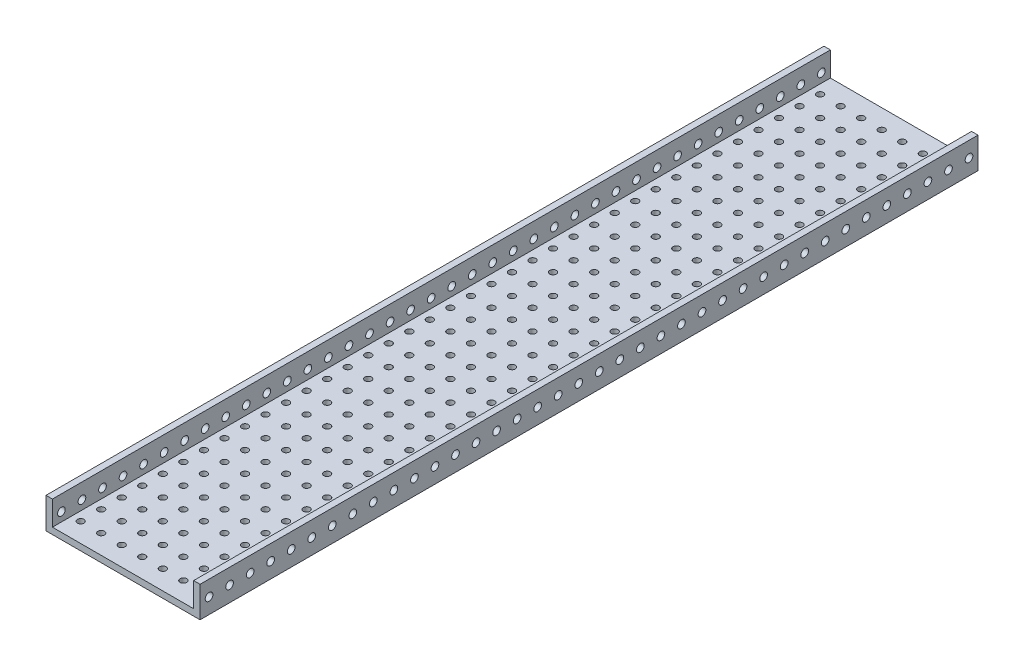
from build123d import *

# Parameters (mm, degrees)
EXTRUDE1_DEPTH        = 192.405
F_6_CLEARANCE_HOLE1_D = 3.7973
LPATTERN1_COUNT       = 38
LPATTERN1_PITCH       = 10.16
F_4_CLEARANCE_HOLE1_D = 3.2639
LPATTERN2_COUNT       = 4
LPATTERN2_PITCH       = 10.16
LPATTERN2_COL_COUNT   = 4
LPATTERN2_COL_PITCH   = 10.16
LPATTERN3_COUNT       = 37
LPATTERN3_PITCH       = 10.16
LPATTERN3_COPY_1_D    = 3.2639
LPATTERN3_COPY_2_D    = 3.2639
LPATTERN3_COPY_3_D    = 3.2639
LPATTERN3_COPY_4_D    = 3.2639
LPATTERN3_COPY_5_D    = 3.2639
LPATTERN3_COPY_6_D    = 3.2639
LPATTERN3_COPY_7_D    = 3.2639
LPATTERN3_COPY_8_D    = 3.2639
LPATTERN3_COPY_9_D    = 3.2639
LPATTERN3_COPY_10_D   = 3.2639
LPATTERN3_COPY_11_D   = 3.2639
LPATTERN3_COPY_12_D   = 3.2639
LPATTERN3_COPY_13_D   = 3.2639
LPATTERN3_COPY_14_D   = 3.2639
LPATTERN3_COPY_15_D   = 3.2639
LPATTERN3_COPY_16_D   = 3.2639
LPATTERN3_COPY_17_D   = 3.2639
LPATTERN3_COPY_18_D   = 3.2639
LPATTERN3_COPY_19_D   = 3.2639
LPATTERN3_COPY_20_D   = 3.2639
LPATTERN3_COPY_21_D   = 3.2639
LPATTERN3_COPY_22_D   = 3.2639
LPATTERN3_COPY_23_D   = 3.2639
LPATTERN3_COPY_24_D   = 3.2639
LPATTERN3_COPY_25_D   = 3.2639
LPATTERN3_COPY_26_D   = 3.2639
LPATTERN3_COPY_27_D   = 3.2639
LPATTERN3_COPY_28_D   = 3.2639
LPATTERN3_COPY_29_D   = 3.2639
LPATTERN3_COPY_30_D   = 3.2639
LPATTERN3_COPY_31_D   = 3.2639
LPATTERN3_COPY_32_D   = 3.2639
LPATTERN3_COPY_33_D   = 3.2639
LPATTERN3_COPY_34_D   = 3.2639
LPATTERN3_COPY_35_D   = 3.2639
LPATTERN3_COPY_36_D   = 3.2639
LPATTERN3_COPY_37_D   = 3.2639
LPATTERN3_COPY_38_D   = 3.2639
LPATTERN3_COPY_39_D   = 3.2639
LPATTERN3_COPY_40_D   = 3.2639
LPATTERN3_COPY_41_D   = 3.2639
LPATTERN3_COPY_42_D   = 3.2639
LPATTERN3_COPY_43_D   = 3.2639
LPATTERN3_COPY_44_D   = 3.2639
LPATTERN3_COPY_45_D   = 3.2639
LPATTERN3_COPY_46_D   = 3.2639
LPATTERN3_COPY_47_D   = 3.2639
LPATTERN3_COPY_48_D   = 3.2639
LPATTERN3_COPY_49_D   = 3.2639
LPATTERN3_COPY_50_D   = 3.2639
LPATTERN3_COPY_51_D   = 3.2639
LPATTERN3_COPY_52_D   = 3.2639
LPATTERN3_COPY_53_D   = 3.2639
LPATTERN3_COPY_54_D   = 3.2639
LPATTERN3_COPY_55_D   = 3.2639
LPATTERN3_COPY_56_D   = 3.2639
LPATTERN3_COPY_57_D   = 3.2639
LPATTERN3_COPY_58_D   = 3.2639
LPATTERN3_COPY_59_D   = 3.2639
LPATTERN3_COPY_60_D   = 3.2639
LPATTERN3_COPY_61_D   = 3.2639
LPATTERN3_COPY_62_D   = 3.2639
LPATTERN3_COPY_63_D   = 3.2639
LPATTERN3_COPY_64_D   = 3.2639
LPATTERN3_COPY_65_D   = 3.2639
LPATTERN3_COPY_66_D   = 3.2639
LPATTERN3_COPY_67_D   = 3.2639
LPATTERN3_COPY_68_D   = 3.2639
LPATTERN3_COPY_69_D   = 3.2639
LPATTERN3_COPY_70_D   = 3.2639
LPATTERN3_COPY_71_D   = 3.2639
LPATTERN3_COPY_72_D   = 3.2639
LPATTERN3_COPY_73_D   = 3.2639
LPATTERN3_COPY_74_D   = 3.2639
LPATTERN3_COPY_75_D   = 3.2639
LPATTERN3_COPY_76_D   = 3.2639
LPATTERN3_COPY_77_D   = 3.2639
LPATTERN3_COPY_78_D   = 3.2639
LPATTERN3_COPY_79_D   = 3.2639
LPATTERN3_COPY_80_D   = 3.2639
LPATTERN3_COPY_81_D   = 3.2639
LPATTERN3_COPY_82_D   = 3.2639
LPATTERN3_COPY_83_D   = 3.2639
LPATTERN3_COPY_84_D   = 3.2639
LPATTERN3_COPY_85_D   = 3.2639
LPATTERN3_COPY_86_D   = 3.2639
LPATTERN3_COPY_87_D   = 3.2639
LPATTERN3_COPY_88_D   = 3.2639
LPATTERN3_COPY_89_D   = 3.2639
LPATTERN3_COPY_90_D   = 3.2639
LPATTERN3_COPY_91_D   = 3.2639
LPATTERN3_COPY_92_D   = 3.2639
LPATTERN3_COPY_93_D   = 3.2639
LPATTERN3_COPY_94_D   = 3.2639
LPATTERN3_COPY_95_D   = 3.2639
LPATTERN3_COPY_96_D   = 3.2639
LPATTERN3_COPY_97_D   = 3.2639
LPATTERN3_COPY_98_D   = 3.2639
LPATTERN3_COPY_99_D   = 3.2639
LPATTERN3_COPY_100_D  = 3.2639
LPATTERN3_COPY_101_D  = 3.2639
LPATTERN3_COPY_102_D  = 3.2639
LPATTERN3_COPY_103_D  = 3.2639
LPATTERN3_COPY_104_D  = 3.2639
LPATTERN3_COPY_105_D  = 3.2639
LPATTERN3_COPY_106_D  = 3.2639
LPATTERN3_COPY_107_D  = 3.2639
LPATTERN3_COPY_108_D  = 3.2639
LPATTERN3_COPY_109_D  = 3.2639
LPATTERN3_COPY_110_D  = 3.2639
LPATTERN3_COPY_111_D  = 3.2639
LPATTERN3_COPY_112_D  = 3.2639
LPATTERN3_COPY_113_D  = 3.2639
LPATTERN3_COPY_114_D  = 3.2639
LPATTERN3_COPY_115_D  = 3.2639
LPATTERN3_COPY_116_D  = 3.2639
LPATTERN3_COPY_117_D  = 3.2639
LPATTERN3_COPY_118_D  = 3.2639
LPATTERN3_COPY_119_D  = 3.2639
LPATTERN3_COPY_120_D  = 3.2639
LPATTERN3_COPY_121_D  = 3.2639
LPATTERN3_COPY_122_D  = 3.2639
LPATTERN3_COPY_123_D  = 3.2639
LPATTERN3_COPY_124_D  = 3.2639
LPATTERN3_COPY_125_D  = 3.2639
LPATTERN3_COPY_126_D  = 3.2639
LPATTERN3_COPY_127_D  = 3.2639
LPATTERN3_COPY_128_D  = 3.2639
LPATTERN3_COPY_129_D  = 3.2639
LPATTERN3_COPY_130_D  = 3.2639
LPATTERN3_COPY_131_D  = 3.2639
LPATTERN3_COPY_132_D  = 3.2639
LPATTERN3_COPY_133_D  = 3.2639
LPATTERN3_COPY_134_D  = 3.2639
LPATTERN3_COPY_135_D  = 3.2639
LPATTERN3_COPY_136_D  = 3.2639
LPATTERN3_COPY_137_D  = 3.2639
LPATTERN3_COPY_138_D  = 3.2639
LPATTERN3_COPY_139_D  = 3.2639
LPATTERN3_COPY_140_D  = 3.2639
LPATTERN3_COPY_141_D  = 3.2639
LPATTERN3_COPY_142_D  = 3.2639
LPATTERN3_COPY_143_D  = 3.2639
LPATTERN3_COPY_144_D  = 3.2639
LPATTERN3_COPY_145_D  = 3.2639
LPATTERN3_COPY_146_D  = 3.2639
LPATTERN3_COPY_147_D  = 3.2639
LPATTERN3_COPY_148_D  = 3.2639
LPATTERN3_COPY_149_D  = 3.2639
LPATTERN3_COPY_150_D  = 3.2639
LPATTERN3_COPY_151_D  = 3.2639
LPATTERN3_COPY_152_D  = 3.2639
LPATTERN3_COPY_153_D  = 3.2639
LPATTERN3_COPY_154_D  = 3.2639
LPATTERN3_COPY_155_D  = 3.2639
LPATTERN3_COPY_156_D  = 3.2639
LPATTERN3_COPY_157_D  = 3.2639
LPATTERN3_COPY_158_D  = 3.2639
LPATTERN3_COPY_159_D  = 3.2639
LPATTERN3_COPY_160_D  = 3.2639
LPATTERN3_COPY_161_D  = 3.2639
LPATTERN3_COPY_162_D  = 3.2639
LPATTERN3_COPY_163_D  = 3.2639
LPATTERN3_COPY_164_D  = 3.2639
LPATTERN3_COPY_165_D  = 3.2639
LPATTERN3_COPY_166_D  = 3.2639
LPATTERN3_COPY_167_D  = 3.2639
LPATTERN3_COPY_168_D  = 3.2639
LPATTERN3_COPY_169_D  = 3.2639
LPATTERN3_COPY_170_D  = 3.2639
LPATTERN3_COPY_171_D  = 3.2639
LPATTERN3_COPY_172_D  = 3.2639
LPATTERN3_COPY_173_D  = 3.2639
LPATTERN3_COPY_174_D  = 3.2639
LPATTERN3_COPY_175_D  = 3.2639
LPATTERN3_COPY_176_D  = 3.2639
LPATTERN3_COPY_177_D  = 3.2639
LPATTERN3_COPY_178_D  = 3.2639
LPATTERN3_COPY_179_D  = 3.2639
LPATTERN3_COPY_180_D  = 3.2639
LPATTERN3_COPY_181_D  = 3.2639
LPATTERN3_COPY_182_D  = 3.2639
LPATTERN3_COPY_183_D  = 3.2639
LPATTERN3_COPY_184_D  = 3.2639
LPATTERN3_COPY_185_D  = 3.2639
LPATTERN3_COPY_186_D  = 3.2639
LPATTERN3_COPY_187_D  = 3.2639
LPATTERN3_COPY_188_D  = 3.2639
LPATTERN3_COPY_189_D  = 3.2639
LPATTERN3_COPY_190_D  = 3.2639
LPATTERN3_COPY_191_D  = 3.2639
LPATTERN3_COPY_192_D  = 3.2639
LPATTERN3_COPY_193_D  = 3.2639
LPATTERN3_COPY_194_D  = 3.2639
LPATTERN3_COPY_195_D  = 3.2639
LPATTERN3_COPY_196_D  = 3.2639
LPATTERN3_COPY_197_D  = 3.2639
LPATTERN3_COPY_198_D  = 3.2639
LPATTERN3_COPY_199_D  = 3.2639
LPATTERN3_COPY_200_D  = 3.2639
LPATTERN3_COPY_201_D  = 3.2639
LPATTERN3_COPY_202_D  = 3.2639
LPATTERN3_COPY_203_D  = 3.2639
LPATTERN3_COPY_204_D  = 3.2639
LPATTERN3_COPY_205_D  = 3.2639
LPATTERN3_COPY_206_D  = 3.2639
LPATTERN3_COPY_207_D  = 3.2639
LPATTERN3_COPY_208_D  = 3.2639
LPATTERN3_COPY_209_D  = 3.2639
LPATTERN3_COPY_210_D  = 3.2639
LPATTERN3_COPY_211_D  = 3.2639
LPATTERN3_COPY_212_D  = 3.2639
LPATTERN3_COPY_213_D  = 3.2639
LPATTERN3_COPY_214_D  = 3.2639
LPATTERN3_COPY_215_D  = 3.2639
LPATTERN3_COPY_216_D  = 3.2639


with BuildPart() as part:
    # Sketch1 → Extrude1 (new, symmetric)
    with BuildSketch(Plane.XY):
        Polygon((0, 0), (38.1, 0), (38.1, 15.24), (34.925, 15.24), (34.925, 3.175), (-34.925, 3.175), (-34.925, 15.24), (-38.1, 15.24), (-38.1, 0), align=None)
    extrude(amount=EXTRUDE1_DEPTH, both=True)

    # #6 Clearance Hole1 (through all)
    with Locations(Plane(origin=(38.1, 7.62, 187.96), x_dir=(0, 0, 1), z_dir=(1, 0, 0))):
        with Locations((0, 0)):
            f_6_clearance_hole1 = Hole(F_6_CLEARANCE_HOLE1_D / 2)

    # LPattern1: #6 Clearance Hole1 ×38
    with Locations(*[(0, 0, -i * LPATTERN1_PITCH) for i in range(1, LPATTERN1_COUNT)]):
        add(f_6_clearance_hole1, mode=Mode.SUBTRACT)

    # #4 Clearance Hole1 (through all)
    with Locations(Plane(origin=(0, 0, 182.88), x_dir=(0, 0, -1), z_dir=(0, -1, 0))):
        with Locations((0, 0)):
            f_4_clearance_hole1 = Hole(F_4_CLEARANCE_HOLE1_D / 2)

    # LPattern2: #4 Clearance Hole1 ×4
    with Locations(*[(i * LPATTERN2_PITCH, 0, 0) for i in range(1, LPATTERN2_COUNT)]):
        add(f_4_clearance_hole1, mode=Mode.SUBTRACT)

    # LPattern2 col: #4 Clearance Hole1 ×4
    with Locations(*[(-i * LPATTERN2_COL_PITCH, 0, 0) for i in range(1, LPATTERN2_COL_COUNT)]):
        add(f_4_clearance_hole1, mode=Mode.SUBTRACT)

    # LPattern3: #4 Clearance Hole1 ×37
    with Locations(*[(0, 0, -i * LPATTERN3_PITCH) for i in range(1, LPATTERN3_COUNT)]):
        add(f_4_clearance_hole1, mode=Mode.SUBTRACT)

    # LPattern3 copy 1 (through all)
    with Locations(Plane(origin=(10.16, 0, 172.72), x_dir=(0, 0, -1), z_dir=(0, -1, 0))):
        with Locations((0, 0)):
            Hole(LPATTERN3_COPY_1_D / 2)

    # LPattern3 copy 2 (through all)
    with Locations(Plane(origin=(10.16, 0, 162.56), x_dir=(0, 0, -1), z_dir=(0, -1, 0))):
        with Locations((0, 0)):
            Hole(LPATTERN3_COPY_2_D / 2)

    # LPattern3 copy 3 (through all)
    with Locations(Plane(origin=(10.16, 0, 152.4), x_dir=(0, 0, -1), z_dir=(0, -1, 0))):
        with Locations((0, 0)):
            Hole(LPATTERN3_COPY_3_D / 2)

    # LPattern3 copy 4 (through all)
    with Locations(Plane(origin=(10.16, 0, 142.24), x_dir=(0, 0, -1), z_dir=(0, -1, 0))):
        with Locations((0, 0)):
            Hole(LPATTERN3_COPY_4_D / 2)

    # LPattern3 copy 5 (through all)
    with Locations(Plane(origin=(10.16, 0, 132.08), x_dir=(0, 0, -1), z_dir=(0, -1, 0))):
        with Locations((0, 0)):
            Hole(LPATTERN3_COPY_5_D / 2)

    # LPattern3 copy 6 (through all)
    with Locations(Plane(origin=(10.16, 0, 121.92), x_dir=(0, 0, -1), z_dir=(0, -1, 0))):
        with Locations((0, 0)):
            Hole(LPATTERN3_COPY_6_D / 2)

    # LPattern3 copy 7 (through all)
    with Locations(Plane(origin=(10.16, 0, 111.76), x_dir=(0, 0, -1), z_dir=(0, -1, 0))):
        with Locations((0, 0)):
            Hole(LPATTERN3_COPY_7_D / 2)

    # LPattern3 copy 8 (through all)
    with Locations(Plane(origin=(10.16, 0, 101.6), x_dir=(0, 0, -1), z_dir=(0, -1, 0))):
        with Locations((0, 0)):
            Hole(LPATTERN3_COPY_8_D / 2)

    # LPattern3 copy 9 (through all)
    with Locations(Plane(origin=(10.16, 0, 91.44), x_dir=(0, 0, -1), z_dir=(0, -1, 0))):
        with Locations((0, 0)):
            Hole(LPATTERN3_COPY_9_D / 2)

    # LPattern3 copy 10 (through all)
    with Locations(Plane(origin=(10.16, 0, 81.28), x_dir=(0, 0, -1), z_dir=(0, -1, 0))):
        with Locations((0, 0)):
            Hole(LPATTERN3_COPY_10_D / 2)

    # LPattern3 copy 11 (through all)
    with Locations(Plane(origin=(10.16, 0, 71.12), x_dir=(0, 0, -1), z_dir=(0, -1, 0))):
        with Locations((0, 0)):
            Hole(LPATTERN3_COPY_11_D / 2)

    # LPattern3 copy 12 (through all)
    with Locations(Plane(origin=(10.16, 0, 60.96), x_dir=(0, 0, -1), z_dir=(0, -1, 0))):
        with Locations((0, 0)):
            Hole(LPATTERN3_COPY_12_D / 2)

    # LPattern3 copy 13 (through all)
    with Locations(Plane(origin=(10.16, 0, 50.8), x_dir=(0, 0, -1), z_dir=(0, -1, 0))):
        with Locations((0, 0)):
            Hole(LPATTERN3_COPY_13_D / 2)

    # LPattern3 copy 14 (through all)
    with Locations(Plane(origin=(10.16, 0, 40.64), x_dir=(0, 0, -1), z_dir=(0, -1, 0))):
        with Locations((0, 0)):
            Hole(LPATTERN3_COPY_14_D / 2)

    # LPattern3 copy 15 (through all)
    with Locations(Plane(origin=(10.16, 0, 30.48), x_dir=(0, 0, -1), z_dir=(0, -1, 0))):
        with Locations((0, 0)):
            Hole(LPATTERN3_COPY_15_D / 2)

    # LPattern3 copy 16 (through all)
    with Locations(Plane(origin=(10.16, 0, 20.32), x_dir=(0, 0, -1), z_dir=(0, -1, 0))):
        with Locations((0, 0)):
            Hole(LPATTERN3_COPY_16_D / 2)

    # LPattern3 copy 17 (through all)
    with Locations(Plane(origin=(10.16, 0, 10.16), x_dir=(0, 0, -1), z_dir=(0, -1, 0))):
        with Locations((0, 0)):
            Hole(LPATTERN3_COPY_17_D / 2)

    # LPattern3 copy 18 (through all)
    with Locations(Plane(origin=(10.16, 0, 0), x_dir=(0, 0, -1), z_dir=(0, -1, 0))):
        with Locations((0, 0)):
            Hole(LPATTERN3_COPY_18_D / 2)

    # LPattern3 copy 19 (through all)
    with Locations(Plane(origin=(10.16, 0, -10.16), x_dir=(0, 0, -1), z_dir=(0, -1, 0))):
        with Locations((0, 0)):
            Hole(LPATTERN3_COPY_19_D / 2)

    # LPattern3 copy 20 (through all)
    with Locations(Plane(origin=(10.16, 0, -20.32), x_dir=(0, 0, -1), z_dir=(0, -1, 0))):
        with Locations((0, 0)):
            Hole(LPATTERN3_COPY_20_D / 2)

    # LPattern3 copy 21 (through all)
    with Locations(Plane(origin=(10.16, 0, -30.48), x_dir=(0, 0, -1), z_dir=(0, -1, 0))):
        with Locations((0, 0)):
            Hole(LPATTERN3_COPY_21_D / 2)

    # LPattern3 copy 22 (through all)
    with Locations(Plane(origin=(10.16, 0, -40.64), x_dir=(0, 0, -1), z_dir=(0, -1, 0))):
        with Locations((0, 0)):
            Hole(LPATTERN3_COPY_22_D / 2)

    # LPattern3 copy 23 (through all)
    with Locations(Plane(origin=(10.16, 0, -50.8), x_dir=(0, 0, -1), z_dir=(0, -1, 0))):
        with Locations((0, 0)):
            Hole(LPATTERN3_COPY_23_D / 2)

    # LPattern3 copy 24 (through all)
    with Locations(Plane(origin=(10.16, 0, -60.96), x_dir=(0, 0, -1), z_dir=(0, -1, 0))):
        with Locations((0, 0)):
            Hole(LPATTERN3_COPY_24_D / 2)

    # LPattern3 copy 25 (through all)
    with Locations(Plane(origin=(10.16, 0, -71.12), x_dir=(0, 0, -1), z_dir=(0, -1, 0))):
        with Locations((0, 0)):
            Hole(LPATTERN3_COPY_25_D / 2)

    # LPattern3 copy 26 (through all)
    with Locations(Plane(origin=(10.16, 0, -81.28), x_dir=(0, 0, -1), z_dir=(0, -1, 0))):
        with Locations((0, 0)):
            Hole(LPATTERN3_COPY_26_D / 2)

    # LPattern3 copy 27 (through all)
    with Locations(Plane(origin=(10.16, 0, -91.44), x_dir=(0, 0, -1), z_dir=(0, -1, 0))):
        with Locations((0, 0)):
            Hole(LPATTERN3_COPY_27_D / 2)

    # LPattern3 copy 28 (through all)
    with Locations(Plane(origin=(10.16, 0, -101.6), x_dir=(0, 0, -1), z_dir=(0, -1, 0))):
        with Locations((0, 0)):
            Hole(LPATTERN3_COPY_28_D / 2)

    # LPattern3 copy 29 (through all)
    with Locations(Plane(origin=(10.16, 0, -111.76), x_dir=(0, 0, -1), z_dir=(0, -1, 0))):
        with Locations((0, 0)):
            Hole(LPATTERN3_COPY_29_D / 2)

    # LPattern3 copy 30 (through all)
    with Locations(Plane(origin=(10.16, 0, -121.92), x_dir=(0, 0, -1), z_dir=(0, -1, 0))):
        with Locations((0, 0)):
            Hole(LPATTERN3_COPY_30_D / 2)

    # LPattern3 copy 31 (through all)
    with Locations(Plane(origin=(10.16, 0, -132.08), x_dir=(0, 0, -1), z_dir=(0, -1, 0))):
        with Locations((0, 0)):
            Hole(LPATTERN3_COPY_31_D / 2)

    # LPattern3 copy 32 (through all)
    with Locations(Plane(origin=(10.16, 0, -142.24), x_dir=(0, 0, -1), z_dir=(0, -1, 0))):
        with Locations((0, 0)):
            Hole(LPATTERN3_COPY_32_D / 2)

    # LPattern3 copy 33 (through all)
    with Locations(Plane(origin=(10.16, 0, -152.4), x_dir=(0, 0, -1), z_dir=(0, -1, 0))):
        with Locations((0, 0)):
            Hole(LPATTERN3_COPY_33_D / 2)

    # LPattern3 copy 34 (through all)
    with Locations(Plane(origin=(10.16, 0, -162.56), x_dir=(0, 0, -1), z_dir=(0, -1, 0))):
        with Locations((0, 0)):
            Hole(LPATTERN3_COPY_34_D / 2)

    # LPattern3 copy 35 (through all)
    with Locations(Plane(origin=(10.16, 0, -172.72), x_dir=(0, 0, -1), z_dir=(0, -1, 0))):
        with Locations((0, 0)):
            Hole(LPATTERN3_COPY_35_D / 2)

    # LPattern3 copy 36 (through all)
    with Locations(Plane(origin=(10.16, 0, -182.88), x_dir=(0, 0, -1), z_dir=(0, -1, 0))):
        with Locations((0, 0)):
            Hole(LPATTERN3_COPY_36_D / 2)

    # LPattern3 copy 37 (through all)
    with Locations(Plane(origin=(20.32, 0, 172.72), x_dir=(0, 0, -1), z_dir=(0, -1, 0))):
        with Locations((0, 0)):
            Hole(LPATTERN3_COPY_37_D / 2)

    # LPattern3 copy 38 (through all)
    with Locations(Plane(origin=(20.32, 0, 162.56), x_dir=(0, 0, -1), z_dir=(0, -1, 0))):
        with Locations((0, 0)):
            Hole(LPATTERN3_COPY_38_D / 2)

    # LPattern3 copy 39 (through all)
    with Locations(Plane(origin=(20.32, 0, 152.4), x_dir=(0, 0, -1), z_dir=(0, -1, 0))):
        with Locations((0, 0)):
            Hole(LPATTERN3_COPY_39_D / 2)

    # LPattern3 copy 40 (through all)
    with Locations(Plane(origin=(20.32, 0, 142.24), x_dir=(0, 0, -1), z_dir=(0, -1, 0))):
        with Locations((0, 0)):
            Hole(LPATTERN3_COPY_40_D / 2)

    # LPattern3 copy 41 (through all)
    with Locations(Plane(origin=(20.32, 0, 132.08), x_dir=(0, 0, -1), z_dir=(0, -1, 0))):
        with Locations((0, 0)):
            Hole(LPATTERN3_COPY_41_D / 2)

    # LPattern3 copy 42 (through all)
    with Locations(Plane(origin=(20.32, 0, 121.92), x_dir=(0, 0, -1), z_dir=(0, -1, 0))):
        with Locations((0, 0)):
            Hole(LPATTERN3_COPY_42_D / 2)

    # LPattern3 copy 43 (through all)
    with Locations(Plane(origin=(20.32, 0, 111.76), x_dir=(0, 0, -1), z_dir=(0, -1, 0))):
        with Locations((0, 0)):
            Hole(LPATTERN3_COPY_43_D / 2)

    # LPattern3 copy 44 (through all)
    with Locations(Plane(origin=(20.32, 0, 101.6), x_dir=(0, 0, -1), z_dir=(0, -1, 0))):
        with Locations((0, 0)):
            Hole(LPATTERN3_COPY_44_D / 2)

    # LPattern3 copy 45 (through all)
    with Locations(Plane(origin=(20.32, 0, 91.44), x_dir=(0, 0, -1), z_dir=(0, -1, 0))):
        with Locations((0, 0)):
            Hole(LPATTERN3_COPY_45_D / 2)

    # LPattern3 copy 46 (through all)
    with Locations(Plane(origin=(20.32, 0, 81.28), x_dir=(0, 0, -1), z_dir=(0, -1, 0))):
        with Locations((0, 0)):
            Hole(LPATTERN3_COPY_46_D / 2)

    # LPattern3 copy 47 (through all)
    with Locations(Plane(origin=(20.32, 0, 71.12), x_dir=(0, 0, -1), z_dir=(0, -1, 0))):
        with Locations((0, 0)):
            Hole(LPATTERN3_COPY_47_D / 2)

    # LPattern3 copy 48 (through all)
    with Locations(Plane(origin=(20.32, 0, 60.96), x_dir=(0, 0, -1), z_dir=(0, -1, 0))):
        with Locations((0, 0)):
            Hole(LPATTERN3_COPY_48_D / 2)

    # LPattern3 copy 49 (through all)
    with Locations(Plane(origin=(20.32, 0, 50.8), x_dir=(0, 0, -1), z_dir=(0, -1, 0))):
        with Locations((0, 0)):
            Hole(LPATTERN3_COPY_49_D / 2)

    # LPattern3 copy 50 (through all)
    with Locations(Plane(origin=(20.32, 0, 40.64), x_dir=(0, 0, -1), z_dir=(0, -1, 0))):
        with Locations((0, 0)):
            Hole(LPATTERN3_COPY_50_D / 2)

    # LPattern3 copy 51 (through all)
    with Locations(Plane(origin=(20.32, 0, 30.48), x_dir=(0, 0, -1), z_dir=(0, -1, 0))):
        with Locations((0, 0)):
            Hole(LPATTERN3_COPY_51_D / 2)

    # LPattern3 copy 52 (through all)
    with Locations(Plane(origin=(20.32, 0, 20.32), x_dir=(0, 0, -1), z_dir=(0, -1, 0))):
        with Locations((0, 0)):
            Hole(LPATTERN3_COPY_52_D / 2)

    # LPattern3 copy 53 (through all)
    with Locations(Plane(origin=(20.32, 0, 10.16), x_dir=(0, 0, -1), z_dir=(0, -1, 0))):
        with Locations((0, 0)):
            Hole(LPATTERN3_COPY_53_D / 2)

    # LPattern3 copy 54 (through all)
    with Locations(Plane(origin=(20.32, 0, 0), x_dir=(0, 0, -1), z_dir=(0, -1, 0))):
        with Locations((0, 0)):
            Hole(LPATTERN3_COPY_54_D / 2)

    # LPattern3 copy 55 (through all)
    with Locations(Plane(origin=(20.32, 0, -10.16), x_dir=(0, 0, -1), z_dir=(0, -1, 0))):
        with Locations((0, 0)):
            Hole(LPATTERN3_COPY_55_D / 2)

    # LPattern3 copy 56 (through all)
    with Locations(Plane(origin=(20.32, 0, -20.32), x_dir=(0, 0, -1), z_dir=(0, -1, 0))):
        with Locations((0, 0)):
            Hole(LPATTERN3_COPY_56_D / 2)

    # LPattern3 copy 57 (through all)
    with Locations(Plane(origin=(20.32, 0, -30.48), x_dir=(0, 0, -1), z_dir=(0, -1, 0))):
        with Locations((0, 0)):
            Hole(LPATTERN3_COPY_57_D / 2)

    # LPattern3 copy 58 (through all)
    with Locations(Plane(origin=(20.32, 0, -40.64), x_dir=(0, 0, -1), z_dir=(0, -1, 0))):
        with Locations((0, 0)):
            Hole(LPATTERN3_COPY_58_D / 2)

    # LPattern3 copy 59 (through all)
    with Locations(Plane(origin=(20.32, 0, -50.8), x_dir=(0, 0, -1), z_dir=(0, -1, 0))):
        with Locations((0, 0)):
            Hole(LPATTERN3_COPY_59_D / 2)

    # LPattern3 copy 60 (through all)
    with Locations(Plane(origin=(20.32, 0, -60.96), x_dir=(0, 0, -1), z_dir=(0, -1, 0))):
        with Locations((0, 0)):
            Hole(LPATTERN3_COPY_60_D / 2)

    # LPattern3 copy 61 (through all)
    with Locations(Plane(origin=(20.32, 0, -71.12), x_dir=(0, 0, -1), z_dir=(0, -1, 0))):
        with Locations((0, 0)):
            Hole(LPATTERN3_COPY_61_D / 2)

    # LPattern3 copy 62 (through all)
    with Locations(Plane(origin=(20.32, 0, -81.28), x_dir=(0, 0, -1), z_dir=(0, -1, 0))):
        with Locations((0, 0)):
            Hole(LPATTERN3_COPY_62_D / 2)

    # LPattern3 copy 63 (through all)
    with Locations(Plane(origin=(20.32, 0, -91.44), x_dir=(0, 0, -1), z_dir=(0, -1, 0))):
        with Locations((0, 0)):
            Hole(LPATTERN3_COPY_63_D / 2)

    # LPattern3 copy 64 (through all)
    with Locations(Plane(origin=(20.32, 0, -101.6), x_dir=(0, 0, -1), z_dir=(0, -1, 0))):
        with Locations((0, 0)):
            Hole(LPATTERN3_COPY_64_D / 2)

    # LPattern3 copy 65 (through all)
    with Locations(Plane(origin=(20.32, 0, -111.76), x_dir=(0, 0, -1), z_dir=(0, -1, 0))):
        with Locations((0, 0)):
            Hole(LPATTERN3_COPY_65_D / 2)

    # LPattern3 copy 66 (through all)
    with Locations(Plane(origin=(20.32, 0, -121.92), x_dir=(0, 0, -1), z_dir=(0, -1, 0))):
        with Locations((0, 0)):
            Hole(LPATTERN3_COPY_66_D / 2)

    # LPattern3 copy 67 (through all)
    with Locations(Plane(origin=(20.32, 0, -132.08), x_dir=(0, 0, -1), z_dir=(0, -1, 0))):
        with Locations((0, 0)):
            Hole(LPATTERN3_COPY_67_D / 2)

    # LPattern3 copy 68 (through all)
    with Locations(Plane(origin=(20.32, 0, -142.24), x_dir=(0, 0, -1), z_dir=(0, -1, 0))):
        with Locations((0, 0)):
            Hole(LPATTERN3_COPY_68_D / 2)

    # LPattern3 copy 69 (through all)
    with Locations(Plane(origin=(20.32, 0, -152.4), x_dir=(0, 0, -1), z_dir=(0, -1, 0))):
        with Locations((0, 0)):
            Hole(LPATTERN3_COPY_69_D / 2)

    # LPattern3 copy 70 (through all)
    with Locations(Plane(origin=(20.32, 0, -162.56), x_dir=(0, 0, -1), z_dir=(0, -1, 0))):
        with Locations((0, 0)):
            Hole(LPATTERN3_COPY_70_D / 2)

    # LPattern3 copy 71 (through all)
    with Locations(Plane(origin=(20.32, 0, -172.72), x_dir=(0, 0, -1), z_dir=(0, -1, 0))):
        with Locations((0, 0)):
            Hole(LPATTERN3_COPY_71_D / 2)

    # LPattern3 copy 72 (through all)
    with Locations(Plane(origin=(20.32, 0, -182.88), x_dir=(0, 0, -1), z_dir=(0, -1, 0))):
        with Locations((0, 0)):
            Hole(LPATTERN3_COPY_72_D / 2)

    # LPattern3 copy 73 (through all)
    with Locations(Plane(origin=(30.48, 0, 172.72), x_dir=(0, 0, -1), z_dir=(0, -1, 0))):
        with Locations((0, 0)):
            Hole(LPATTERN3_COPY_73_D / 2)

    # LPattern3 copy 74 (through all)
    with Locations(Plane(origin=(30.48, 0, 162.56), x_dir=(0, 0, -1), z_dir=(0, -1, 0))):
        with Locations((0, 0)):
            Hole(LPATTERN3_COPY_74_D / 2)

    # LPattern3 copy 75 (through all)
    with Locations(Plane(origin=(30.48, 0, 152.4), x_dir=(0, 0, -1), z_dir=(0, -1, 0))):
        with Locations((0, 0)):
            Hole(LPATTERN3_COPY_75_D / 2)

    # LPattern3 copy 76 (through all)
    with Locations(Plane(origin=(30.48, 0, 142.24), x_dir=(0, 0, -1), z_dir=(0, -1, 0))):
        with Locations((0, 0)):
            Hole(LPATTERN3_COPY_76_D / 2)

    # LPattern3 copy 77 (through all)
    with Locations(Plane(origin=(30.48, 0, 132.08), x_dir=(0, 0, -1), z_dir=(0, -1, 0))):
        with Locations((0, 0)):
            Hole(LPATTERN3_COPY_77_D / 2)

    # LPattern3 copy 78 (through all)
    with Locations(Plane(origin=(30.48, 0, 121.92), x_dir=(0, 0, -1), z_dir=(0, -1, 0))):
        with Locations((0, 0)):
            Hole(LPATTERN3_COPY_78_D / 2)

    # LPattern3 copy 79 (through all)
    with Locations(Plane(origin=(30.48, 0, 111.76), x_dir=(0, 0, -1), z_dir=(0, -1, 0))):
        with Locations((0, 0)):
            Hole(LPATTERN3_COPY_79_D / 2)

    # LPattern3 copy 80 (through all)
    with Locations(Plane(origin=(30.48, 0, 101.6), x_dir=(0, 0, -1), z_dir=(0, -1, 0))):
        with Locations((0, 0)):
            Hole(LPATTERN3_COPY_80_D / 2)

    # LPattern3 copy 81 (through all)
    with Locations(Plane(origin=(30.48, 0, 91.44), x_dir=(0, 0, -1), z_dir=(0, -1, 0))):
        with Locations((0, 0)):
            Hole(LPATTERN3_COPY_81_D / 2)

    # LPattern3 copy 82 (through all)
    with Locations(Plane(origin=(30.48, 0, 81.28), x_dir=(0, 0, -1), z_dir=(0, -1, 0))):
        with Locations((0, 0)):
            Hole(LPATTERN3_COPY_82_D / 2)

    # LPattern3 copy 83 (through all)
    with Locations(Plane(origin=(30.48, 0, 71.12), x_dir=(0, 0, -1), z_dir=(0, -1, 0))):
        with Locations((0, 0)):
            Hole(LPATTERN3_COPY_83_D / 2)

    # LPattern3 copy 84 (through all)
    with Locations(Plane(origin=(30.48, 0, 60.96), x_dir=(0, 0, -1), z_dir=(0, -1, 0))):
        with Locations((0, 0)):
            Hole(LPATTERN3_COPY_84_D / 2)

    # LPattern3 copy 85 (through all)
    with Locations(Plane(origin=(30.48, 0, 50.8), x_dir=(0, 0, -1), z_dir=(0, -1, 0))):
        with Locations((0, 0)):
            Hole(LPATTERN3_COPY_85_D / 2)

    # LPattern3 copy 86 (through all)
    with Locations(Plane(origin=(30.48, 0, 40.64), x_dir=(0, 0, -1), z_dir=(0, -1, 0))):
        with Locations((0, 0)):
            Hole(LPATTERN3_COPY_86_D / 2)

    # LPattern3 copy 87 (through all)
    with Locations(Plane(origin=(30.48, 0, 30.48), x_dir=(0, 0, -1), z_dir=(0, -1, 0))):
        with Locations((0, 0)):
            Hole(LPATTERN3_COPY_87_D / 2)

    # LPattern3 copy 88 (through all)
    with Locations(Plane(origin=(30.48, 0, 20.32), x_dir=(0, 0, -1), z_dir=(0, -1, 0))):
        with Locations((0, 0)):
            Hole(LPATTERN3_COPY_88_D / 2)

    # LPattern3 copy 89 (through all)
    with Locations(Plane(origin=(30.48, 0, 10.16), x_dir=(0, 0, -1), z_dir=(0, -1, 0))):
        with Locations((0, 0)):
            Hole(LPATTERN3_COPY_89_D / 2)

    # LPattern3 copy 90 (through all)
    with Locations(Plane(origin=(30.48, 0, 0), x_dir=(0, 0, -1), z_dir=(0, -1, 0))):
        with Locations((0, 0)):
            Hole(LPATTERN3_COPY_90_D / 2)

    # LPattern3 copy 91 (through all)
    with Locations(Plane(origin=(30.48, 0, -10.16), x_dir=(0, 0, -1), z_dir=(0, -1, 0))):
        with Locations((0, 0)):
            Hole(LPATTERN3_COPY_91_D / 2)

    # LPattern3 copy 92 (through all)
    with Locations(Plane(origin=(30.48, 0, -20.32), x_dir=(0, 0, -1), z_dir=(0, -1, 0))):
        with Locations((0, 0)):
            Hole(LPATTERN3_COPY_92_D / 2)

    # LPattern3 copy 93 (through all)
    with Locations(Plane(origin=(30.48, 0, -30.48), x_dir=(0, 0, -1), z_dir=(0, -1, 0))):
        with Locations((0, 0)):
            Hole(LPATTERN3_COPY_93_D / 2)

    # LPattern3 copy 94 (through all)
    with Locations(Plane(origin=(30.48, 0, -40.64), x_dir=(0, 0, -1), z_dir=(0, -1, 0))):
        with Locations((0, 0)):
            Hole(LPATTERN3_COPY_94_D / 2)

    # LPattern3 copy 95 (through all)
    with Locations(Plane(origin=(30.48, 0, -50.8), x_dir=(0, 0, -1), z_dir=(0, -1, 0))):
        with Locations((0, 0)):
            Hole(LPATTERN3_COPY_95_D / 2)

    # LPattern3 copy 96 (through all)
    with Locations(Plane(origin=(30.48, 0, -60.96), x_dir=(0, 0, -1), z_dir=(0, -1, 0))):
        with Locations((0, 0)):
            Hole(LPATTERN3_COPY_96_D / 2)

    # LPattern3 copy 97 (through all)
    with Locations(Plane(origin=(30.48, 0, -71.12), x_dir=(0, 0, -1), z_dir=(0, -1, 0))):
        with Locations((0, 0)):
            Hole(LPATTERN3_COPY_97_D / 2)

    # LPattern3 copy 98 (through all)
    with Locations(Plane(origin=(30.48, 0, -81.28), x_dir=(0, 0, -1), z_dir=(0, -1, 0))):
        with Locations((0, 0)):
            Hole(LPATTERN3_COPY_98_D / 2)

    # LPattern3 copy 99 (through all)
    with Locations(Plane(origin=(30.48, 0, -91.44), x_dir=(0, 0, -1), z_dir=(0, -1, 0))):
        with Locations((0, 0)):
            Hole(LPATTERN3_COPY_99_D / 2)

    # LPattern3 copy 100 (through all)
    with Locations(Plane(origin=(30.48, 0, -101.6), x_dir=(0, 0, -1), z_dir=(0, -1, 0))):
        with Locations((0, 0)):
            Hole(LPATTERN3_COPY_100_D / 2)

    # LPattern3 copy 101 (through all)
    with Locations(Plane(origin=(30.48, 0, -111.76), x_dir=(0, 0, -1), z_dir=(0, -1, 0))):
        with Locations((0, 0)):
            Hole(LPATTERN3_COPY_101_D / 2)

    # LPattern3 copy 102 (through all)
    with Locations(Plane(origin=(30.48, 0, -121.92), x_dir=(0, 0, -1), z_dir=(0, -1, 0))):
        with Locations((0, 0)):
            Hole(LPATTERN3_COPY_102_D / 2)

    # LPattern3 copy 103 (through all)
    with Locations(Plane(origin=(30.48, 0, -132.08), x_dir=(0, 0, -1), z_dir=(0, -1, 0))):
        with Locations((0, 0)):
            Hole(LPATTERN3_COPY_103_D / 2)

    # LPattern3 copy 104 (through all)
    with Locations(Plane(origin=(30.48, 0, -142.24), x_dir=(0, 0, -1), z_dir=(0, -1, 0))):
        with Locations((0, 0)):
            Hole(LPATTERN3_COPY_104_D / 2)

    # LPattern3 copy 105 (through all)
    with Locations(Plane(origin=(30.48, 0, -152.4), x_dir=(0, 0, -1), z_dir=(0, -1, 0))):
        with Locations((0, 0)):
            Hole(LPATTERN3_COPY_105_D / 2)

    # LPattern3 copy 106 (through all)
    with Locations(Plane(origin=(30.48, 0, -162.56), x_dir=(0, 0, -1), z_dir=(0, -1, 0))):
        with Locations((0, 0)):
            Hole(LPATTERN3_COPY_106_D / 2)

    # LPattern3 copy 107 (through all)
    with Locations(Plane(origin=(30.48, 0, -172.72), x_dir=(0, 0, -1), z_dir=(0, -1, 0))):
        with Locations((0, 0)):
            Hole(LPATTERN3_COPY_107_D / 2)

    # LPattern3 copy 108 (through all)
    with Locations(Plane(origin=(30.48, 0, -182.88), x_dir=(0, 0, -1), z_dir=(0, -1, 0))):
        with Locations((0, 0)):
            Hole(LPATTERN3_COPY_108_D / 2)

    # LPattern3 copy 109 (through all)
    with Locations(Plane(origin=(-10.16, 0, 172.72), x_dir=(0, 0, -1), z_dir=(0, -1, 0))):
        with Locations((0, 0)):
            Hole(LPATTERN3_COPY_109_D / 2)

    # LPattern3 copy 110 (through all)
    with Locations(Plane(origin=(-10.16, 0, 162.56), x_dir=(0, 0, -1), z_dir=(0, -1, 0))):
        with Locations((0, 0)):
            Hole(LPATTERN3_COPY_110_D / 2)

    # LPattern3 copy 111 (through all)
    with Locations(Plane(origin=(-10.16, 0, 152.4), x_dir=(0, 0, -1), z_dir=(0, -1, 0))):
        with Locations((0, 0)):
            Hole(LPATTERN3_COPY_111_D / 2)

    # LPattern3 copy 112 (through all)
    with Locations(Plane(origin=(-10.16, 0, 142.24), x_dir=(0, 0, -1), z_dir=(0, -1, 0))):
        with Locations((0, 0)):
            Hole(LPATTERN3_COPY_112_D / 2)

    # LPattern3 copy 113 (through all)
    with Locations(Plane(origin=(-10.16, 0, 132.08), x_dir=(0, 0, -1), z_dir=(0, -1, 0))):
        with Locations((0, 0)):
            Hole(LPATTERN3_COPY_113_D / 2)

    # LPattern3 copy 114 (through all)
    with Locations(Plane(origin=(-10.16, 0, 121.92), x_dir=(0, 0, -1), z_dir=(0, -1, 0))):
        with Locations((0, 0)):
            Hole(LPATTERN3_COPY_114_D / 2)

    # LPattern3 copy 115 (through all)
    with Locations(Plane(origin=(-10.16, 0, 111.76), x_dir=(0, 0, -1), z_dir=(0, -1, 0))):
        with Locations((0, 0)):
            Hole(LPATTERN3_COPY_115_D / 2)

    # LPattern3 copy 116 (through all)
    with Locations(Plane(origin=(-10.16, 0, 101.6), x_dir=(0, 0, -1), z_dir=(0, -1, 0))):
        with Locations((0, 0)):
            Hole(LPATTERN3_COPY_116_D / 2)

    # LPattern3 copy 117 (through all)
    with Locations(Plane(origin=(-10.16, 0, 91.44), x_dir=(0, 0, -1), z_dir=(0, -1, 0))):
        with Locations((0, 0)):
            Hole(LPATTERN3_COPY_117_D / 2)

    # LPattern3 copy 118 (through all)
    with Locations(Plane(origin=(-10.16, 0, 81.28), x_dir=(0, 0, -1), z_dir=(0, -1, 0))):
        with Locations((0, 0)):
            Hole(LPATTERN3_COPY_118_D / 2)

    # LPattern3 copy 119 (through all)
    with Locations(Plane(origin=(-10.16, 0, 71.12), x_dir=(0, 0, -1), z_dir=(0, -1, 0))):
        with Locations((0, 0)):
            Hole(LPATTERN3_COPY_119_D / 2)

    # LPattern3 copy 120 (through all)
    with Locations(Plane(origin=(-10.16, 0, 60.96), x_dir=(0, 0, -1), z_dir=(0, -1, 0))):
        with Locations((0, 0)):
            Hole(LPATTERN3_COPY_120_D / 2)

    # LPattern3 copy 121 (through all)
    with Locations(Plane(origin=(-10.16, 0, 50.8), x_dir=(0, 0, -1), z_dir=(0, -1, 0))):
        with Locations((0, 0)):
            Hole(LPATTERN3_COPY_121_D / 2)

    # LPattern3 copy 122 (through all)
    with Locations(Plane(origin=(-10.16, 0, 40.64), x_dir=(0, 0, -1), z_dir=(0, -1, 0))):
        with Locations((0, 0)):
            Hole(LPATTERN3_COPY_122_D / 2)

    # LPattern3 copy 123 (through all)
    with Locations(Plane(origin=(-10.16, 0, 30.48), x_dir=(0, 0, -1), z_dir=(0, -1, 0))):
        with Locations((0, 0)):
            Hole(LPATTERN3_COPY_123_D / 2)

    # LPattern3 copy 124 (through all)
    with Locations(Plane(origin=(-10.16, 0, 20.32), x_dir=(0, 0, -1), z_dir=(0, -1, 0))):
        with Locations((0, 0)):
            Hole(LPATTERN3_COPY_124_D / 2)

    # LPattern3 copy 125 (through all)
    with Locations(Plane(origin=(-10.16, 0, 10.16), x_dir=(0, 0, -1), z_dir=(0, -1, 0))):
        with Locations((0, 0)):
            Hole(LPATTERN3_COPY_125_D / 2)

    # LPattern3 copy 126 (through all)
    with Locations(Plane(origin=(-10.16, 0, 0), x_dir=(0, 0, -1), z_dir=(0, -1, 0))):
        with Locations((0, 0)):
            Hole(LPATTERN3_COPY_126_D / 2)

    # LPattern3 copy 127 (through all)
    with Locations(Plane(origin=(-10.16, 0, -10.16), x_dir=(0, 0, -1), z_dir=(0, -1, 0))):
        with Locations((0, 0)):
            Hole(LPATTERN3_COPY_127_D / 2)

    # LPattern3 copy 128 (through all)
    with Locations(Plane(origin=(-10.16, 0, -20.32), x_dir=(0, 0, -1), z_dir=(0, -1, 0))):
        with Locations((0, 0)):
            Hole(LPATTERN3_COPY_128_D / 2)

    # LPattern3 copy 129 (through all)
    with Locations(Plane(origin=(-10.16, 0, -30.48), x_dir=(0, 0, -1), z_dir=(0, -1, 0))):
        with Locations((0, 0)):
            Hole(LPATTERN3_COPY_129_D / 2)

    # LPattern3 copy 130 (through all)
    with Locations(Plane(origin=(-10.16, 0, -40.64), x_dir=(0, 0, -1), z_dir=(0, -1, 0))):
        with Locations((0, 0)):
            Hole(LPATTERN3_COPY_130_D / 2)

    # LPattern3 copy 131 (through all)
    with Locations(Plane(origin=(-10.16, 0, -50.8), x_dir=(0, 0, -1), z_dir=(0, -1, 0))):
        with Locations((0, 0)):
            Hole(LPATTERN3_COPY_131_D / 2)

    # LPattern3 copy 132 (through all)
    with Locations(Plane(origin=(-10.16, 0, -60.96), x_dir=(0, 0, -1), z_dir=(0, -1, 0))):
        with Locations((0, 0)):
            Hole(LPATTERN3_COPY_132_D / 2)

    # LPattern3 copy 133 (through all)
    with Locations(Plane(origin=(-10.16, 0, -71.12), x_dir=(0, 0, -1), z_dir=(0, -1, 0))):
        with Locations((0, 0)):
            Hole(LPATTERN3_COPY_133_D / 2)

    # LPattern3 copy 134 (through all)
    with Locations(Plane(origin=(-10.16, 0, -81.28), x_dir=(0, 0, -1), z_dir=(0, -1, 0))):
        with Locations((0, 0)):
            Hole(LPATTERN3_COPY_134_D / 2)

    # LPattern3 copy 135 (through all)
    with Locations(Plane(origin=(-10.16, 0, -91.44), x_dir=(0, 0, -1), z_dir=(0, -1, 0))):
        with Locations((0, 0)):
            Hole(LPATTERN3_COPY_135_D / 2)

    # LPattern3 copy 136 (through all)
    with Locations(Plane(origin=(-10.16, 0, -101.6), x_dir=(0, 0, -1), z_dir=(0, -1, 0))):
        with Locations((0, 0)):
            Hole(LPATTERN3_COPY_136_D / 2)

    # LPattern3 copy 137 (through all)
    with Locations(Plane(origin=(-10.16, 0, -111.76), x_dir=(0, 0, -1), z_dir=(0, -1, 0))):
        with Locations((0, 0)):
            Hole(LPATTERN3_COPY_137_D / 2)

    # LPattern3 copy 138 (through all)
    with Locations(Plane(origin=(-10.16, 0, -121.92), x_dir=(0, 0, -1), z_dir=(0, -1, 0))):
        with Locations((0, 0)):
            Hole(LPATTERN3_COPY_138_D / 2)

    # LPattern3 copy 139 (through all)
    with Locations(Plane(origin=(-10.16, 0, -132.08), x_dir=(0, 0, -1), z_dir=(0, -1, 0))):
        with Locations((0, 0)):
            Hole(LPATTERN3_COPY_139_D / 2)

    # LPattern3 copy 140 (through all)
    with Locations(Plane(origin=(-10.16, 0, -142.24), x_dir=(0, 0, -1), z_dir=(0, -1, 0))):
        with Locations((0, 0)):
            Hole(LPATTERN3_COPY_140_D / 2)

    # LPattern3 copy 141 (through all)
    with Locations(Plane(origin=(-10.16, 0, -152.4), x_dir=(0, 0, -1), z_dir=(0, -1, 0))):
        with Locations((0, 0)):
            Hole(LPATTERN3_COPY_141_D / 2)

    # LPattern3 copy 142 (through all)
    with Locations(Plane(origin=(-10.16, 0, -162.56), x_dir=(0, 0, -1), z_dir=(0, -1, 0))):
        with Locations((0, 0)):
            Hole(LPATTERN3_COPY_142_D / 2)

    # LPattern3 copy 143 (through all)
    with Locations(Plane(origin=(-10.16, 0, -172.72), x_dir=(0, 0, -1), z_dir=(0, -1, 0))):
        with Locations((0, 0)):
            Hole(LPATTERN3_COPY_143_D / 2)

    # LPattern3 copy 144 (through all)
    with Locations(Plane(origin=(-10.16, 0, -182.88), x_dir=(0, 0, -1), z_dir=(0, -1, 0))):
        with Locations((0, 0)):
            Hole(LPATTERN3_COPY_144_D / 2)

    # LPattern3 copy 145 (through all)
    with Locations(Plane(origin=(-20.32, 0, 172.72), x_dir=(0, 0, -1), z_dir=(0, -1, 0))):
        with Locations((0, 0)):
            Hole(LPATTERN3_COPY_145_D / 2)

    # LPattern3 copy 146 (through all)
    with Locations(Plane(origin=(-20.32, 0, 162.56), x_dir=(0, 0, -1), z_dir=(0, -1, 0))):
        with Locations((0, 0)):
            Hole(LPATTERN3_COPY_146_D / 2)

    # LPattern3 copy 147 (through all)
    with Locations(Plane(origin=(-20.32, 0, 152.4), x_dir=(0, 0, -1), z_dir=(0, -1, 0))):
        with Locations((0, 0)):
            Hole(LPATTERN3_COPY_147_D / 2)

    # LPattern3 copy 148 (through all)
    with Locations(Plane(origin=(-20.32, 0, 142.24), x_dir=(0, 0, -1), z_dir=(0, -1, 0))):
        with Locations((0, 0)):
            Hole(LPATTERN3_COPY_148_D / 2)

    # LPattern3 copy 149 (through all)
    with Locations(Plane(origin=(-20.32, 0, 132.08), x_dir=(0, 0, -1), z_dir=(0, -1, 0))):
        with Locations((0, 0)):
            Hole(LPATTERN3_COPY_149_D / 2)

    # LPattern3 copy 150 (through all)
    with Locations(Plane(origin=(-20.32, 0, 121.92), x_dir=(0, 0, -1), z_dir=(0, -1, 0))):
        with Locations((0, 0)):
            Hole(LPATTERN3_COPY_150_D / 2)

    # LPattern3 copy 151 (through all)
    with Locations(Plane(origin=(-20.32, 0, 111.76), x_dir=(0, 0, -1), z_dir=(0, -1, 0))):
        with Locations((0, 0)):
            Hole(LPATTERN3_COPY_151_D / 2)

    # LPattern3 copy 152 (through all)
    with Locations(Plane(origin=(-20.32, 0, 101.6), x_dir=(0, 0, -1), z_dir=(0, -1, 0))):
        with Locations((0, 0)):
            Hole(LPATTERN3_COPY_152_D / 2)

    # LPattern3 copy 153 (through all)
    with Locations(Plane(origin=(-20.32, 0, 91.44), x_dir=(0, 0, -1), z_dir=(0, -1, 0))):
        with Locations((0, 0)):
            Hole(LPATTERN3_COPY_153_D / 2)

    # LPattern3 copy 154 (through all)
    with Locations(Plane(origin=(-20.32, 0, 81.28), x_dir=(0, 0, -1), z_dir=(0, -1, 0))):
        with Locations((0, 0)):
            Hole(LPATTERN3_COPY_154_D / 2)

    # LPattern3 copy 155 (through all)
    with Locations(Plane(origin=(-20.32, 0, 71.12), x_dir=(0, 0, -1), z_dir=(0, -1, 0))):
        with Locations((0, 0)):
            Hole(LPATTERN3_COPY_155_D / 2)

    # LPattern3 copy 156 (through all)
    with Locations(Plane(origin=(-20.32, 0, 60.96), x_dir=(0, 0, -1), z_dir=(0, -1, 0))):
        with Locations((0, 0)):
            Hole(LPATTERN3_COPY_156_D / 2)

    # LPattern3 copy 157 (through all)
    with Locations(Plane(origin=(-20.32, 0, 50.8), x_dir=(0, 0, -1), z_dir=(0, -1, 0))):
        with Locations((0, 0)):
            Hole(LPATTERN3_COPY_157_D / 2)

    # LPattern3 copy 158 (through all)
    with Locations(Plane(origin=(-20.32, 0, 40.64), x_dir=(0, 0, -1), z_dir=(0, -1, 0))):
        with Locations((0, 0)):
            Hole(LPATTERN3_COPY_158_D / 2)

    # LPattern3 copy 159 (through all)
    with Locations(Plane(origin=(-20.32, 0, 30.48), x_dir=(0, 0, -1), z_dir=(0, -1, 0))):
        with Locations((0, 0)):
            Hole(LPATTERN3_COPY_159_D / 2)

    # LPattern3 copy 160 (through all)
    with Locations(Plane(origin=(-20.32, 0, 20.32), x_dir=(0, 0, -1), z_dir=(0, -1, 0))):
        with Locations((0, 0)):
            Hole(LPATTERN3_COPY_160_D / 2)

    # LPattern3 copy 161 (through all)
    with Locations(Plane(origin=(-20.32, 0, 10.16), x_dir=(0, 0, -1), z_dir=(0, -1, 0))):
        with Locations((0, 0)):
            Hole(LPATTERN3_COPY_161_D / 2)

    # LPattern3 copy 162 (through all)
    with Locations(Plane(origin=(-20.32, 0, 0), x_dir=(0, 0, -1), z_dir=(0, -1, 0))):
        with Locations((0, 0)):
            Hole(LPATTERN3_COPY_162_D / 2)

    # LPattern3 copy 163 (through all)
    with Locations(Plane(origin=(-20.32, 0, -10.16), x_dir=(0, 0, -1), z_dir=(0, -1, 0))):
        with Locations((0, 0)):
            Hole(LPATTERN3_COPY_163_D / 2)

    # LPattern3 copy 164 (through all)
    with Locations(Plane(origin=(-20.32, 0, -20.32), x_dir=(0, 0, -1), z_dir=(0, -1, 0))):
        with Locations((0, 0)):
            Hole(LPATTERN3_COPY_164_D / 2)

    # LPattern3 copy 165 (through all)
    with Locations(Plane(origin=(-20.32, 0, -30.48), x_dir=(0, 0, -1), z_dir=(0, -1, 0))):
        with Locations((0, 0)):
            Hole(LPATTERN3_COPY_165_D / 2)

    # LPattern3 copy 166 (through all)
    with Locations(Plane(origin=(-20.32, 0, -40.64), x_dir=(0, 0, -1), z_dir=(0, -1, 0))):
        with Locations((0, 0)):
            Hole(LPATTERN3_COPY_166_D / 2)

    # LPattern3 copy 167 (through all)
    with Locations(Plane(origin=(-20.32, 0, -50.8), x_dir=(0, 0, -1), z_dir=(0, -1, 0))):
        with Locations((0, 0)):
            Hole(LPATTERN3_COPY_167_D / 2)

    # LPattern3 copy 168 (through all)
    with Locations(Plane(origin=(-20.32, 0, -60.96), x_dir=(0, 0, -1), z_dir=(0, -1, 0))):
        with Locations((0, 0)):
            Hole(LPATTERN3_COPY_168_D / 2)

    # LPattern3 copy 169 (through all)
    with Locations(Plane(origin=(-20.32, 0, -71.12), x_dir=(0, 0, -1), z_dir=(0, -1, 0))):
        with Locations((0, 0)):
            Hole(LPATTERN3_COPY_169_D / 2)

    # LPattern3 copy 170 (through all)
    with Locations(Plane(origin=(-20.32, 0, -81.28), x_dir=(0, 0, -1), z_dir=(0, -1, 0))):
        with Locations((0, 0)):
            Hole(LPATTERN3_COPY_170_D / 2)

    # LPattern3 copy 171 (through all)
    with Locations(Plane(origin=(-20.32, 0, -91.44), x_dir=(0, 0, -1), z_dir=(0, -1, 0))):
        with Locations((0, 0)):
            Hole(LPATTERN3_COPY_171_D / 2)

    # LPattern3 copy 172 (through all)
    with Locations(Plane(origin=(-20.32, 0, -101.6), x_dir=(0, 0, -1), z_dir=(0, -1, 0))):
        with Locations((0, 0)):
            Hole(LPATTERN3_COPY_172_D / 2)

    # LPattern3 copy 173 (through all)
    with Locations(Plane(origin=(-20.32, 0, -111.76), x_dir=(0, 0, -1), z_dir=(0, -1, 0))):
        with Locations((0, 0)):
            Hole(LPATTERN3_COPY_173_D / 2)

    # LPattern3 copy 174 (through all)
    with Locations(Plane(origin=(-20.32, 0, -121.92), x_dir=(0, 0, -1), z_dir=(0, -1, 0))):
        with Locations((0, 0)):
            Hole(LPATTERN3_COPY_174_D / 2)

    # LPattern3 copy 175 (through all)
    with Locations(Plane(origin=(-20.32, 0, -132.08), x_dir=(0, 0, -1), z_dir=(0, -1, 0))):
        with Locations((0, 0)):
            Hole(LPATTERN3_COPY_175_D / 2)

    # LPattern3 copy 176 (through all)
    with Locations(Plane(origin=(-20.32, 0, -142.24), x_dir=(0, 0, -1), z_dir=(0, -1, 0))):
        with Locations((0, 0)):
            Hole(LPATTERN3_COPY_176_D / 2)

    # LPattern3 copy 177 (through all)
    with Locations(Plane(origin=(-20.32, 0, -152.4), x_dir=(0, 0, -1), z_dir=(0, -1, 0))):
        with Locations((0, 0)):
            Hole(LPATTERN3_COPY_177_D / 2)

    # LPattern3 copy 178 (through all)
    with Locations(Plane(origin=(-20.32, 0, -162.56), x_dir=(0, 0, -1), z_dir=(0, -1, 0))):
        with Locations((0, 0)):
            Hole(LPATTERN3_COPY_178_D / 2)

    # LPattern3 copy 179 (through all)
    with Locations(Plane(origin=(-20.32, 0, -172.72), x_dir=(0, 0, -1), z_dir=(0, -1, 0))):
        with Locations((0, 0)):
            Hole(LPATTERN3_COPY_179_D / 2)

    # LPattern3 copy 180 (through all)
    with Locations(Plane(origin=(-20.32, 0, -182.88), x_dir=(0, 0, -1), z_dir=(0, -1, 0))):
        with Locations((0, 0)):
            Hole(LPATTERN3_COPY_180_D / 2)

    # LPattern3 copy 181 (through all)
    with Locations(Plane(origin=(-30.48, 0, 172.72), x_dir=(0, 0, -1), z_dir=(0, -1, 0))):
        with Locations((0, 0)):
            Hole(LPATTERN3_COPY_181_D / 2)

    # LPattern3 copy 182 (through all)
    with Locations(Plane(origin=(-30.48, 0, 162.56), x_dir=(0, 0, -1), z_dir=(0, -1, 0))):
        with Locations((0, 0)):
            Hole(LPATTERN3_COPY_182_D / 2)

    # LPattern3 copy 183 (through all)
    with Locations(Plane(origin=(-30.48, 0, 152.4), x_dir=(0, 0, -1), z_dir=(0, -1, 0))):
        with Locations((0, 0)):
            Hole(LPATTERN3_COPY_183_D / 2)

    # LPattern3 copy 184 (through all)
    with Locations(Plane(origin=(-30.48, 0, 142.24), x_dir=(0, 0, -1), z_dir=(0, -1, 0))):
        with Locations((0, 0)):
            Hole(LPATTERN3_COPY_184_D / 2)

    # LPattern3 copy 185 (through all)
    with Locations(Plane(origin=(-30.48, 0, 132.08), x_dir=(0, 0, -1), z_dir=(0, -1, 0))):
        with Locations((0, 0)):
            Hole(LPATTERN3_COPY_185_D / 2)

    # LPattern3 copy 186 (through all)
    with Locations(Plane(origin=(-30.48, 0, 121.92), x_dir=(0, 0, -1), z_dir=(0, -1, 0))):
        with Locations((0, 0)):
            Hole(LPATTERN3_COPY_186_D / 2)

    # LPattern3 copy 187 (through all)
    with Locations(Plane(origin=(-30.48, 0, 111.76), x_dir=(0, 0, -1), z_dir=(0, -1, 0))):
        with Locations((0, 0)):
            Hole(LPATTERN3_COPY_187_D / 2)

    # LPattern3 copy 188 (through all)
    with Locations(Plane(origin=(-30.48, 0, 101.6), x_dir=(0, 0, -1), z_dir=(0, -1, 0))):
        with Locations((0, 0)):
            Hole(LPATTERN3_COPY_188_D / 2)

    # LPattern3 copy 189 (through all)
    with Locations(Plane(origin=(-30.48, 0, 91.44), x_dir=(0, 0, -1), z_dir=(0, -1, 0))):
        with Locations((0, 0)):
            Hole(LPATTERN3_COPY_189_D / 2)

    # LPattern3 copy 190 (through all)
    with Locations(Plane(origin=(-30.48, 0, 81.28), x_dir=(0, 0, -1), z_dir=(0, -1, 0))):
        with Locations((0, 0)):
            Hole(LPATTERN3_COPY_190_D / 2)

    # LPattern3 copy 191 (through all)
    with Locations(Plane(origin=(-30.48, 0, 71.12), x_dir=(0, 0, -1), z_dir=(0, -1, 0))):
        with Locations((0, 0)):
            Hole(LPATTERN3_COPY_191_D / 2)

    # LPattern3 copy 192 (through all)
    with Locations(Plane(origin=(-30.48, 0, 60.96), x_dir=(0, 0, -1), z_dir=(0, -1, 0))):
        with Locations((0, 0)):
            Hole(LPATTERN3_COPY_192_D / 2)

    # LPattern3 copy 193 (through all)
    with Locations(Plane(origin=(-30.48, 0, 50.8), x_dir=(0, 0, -1), z_dir=(0, -1, 0))):
        with Locations((0, 0)):
            Hole(LPATTERN3_COPY_193_D / 2)

    # LPattern3 copy 194 (through all)
    with Locations(Plane(origin=(-30.48, 0, 40.64), x_dir=(0, 0, -1), z_dir=(0, -1, 0))):
        with Locations((0, 0)):
            Hole(LPATTERN3_COPY_194_D / 2)

    # LPattern3 copy 195 (through all)
    with Locations(Plane(origin=(-30.48, 0, 30.48), x_dir=(0, 0, -1), z_dir=(0, -1, 0))):
        with Locations((0, 0)):
            Hole(LPATTERN3_COPY_195_D / 2)

    # LPattern3 copy 196 (through all)
    with Locations(Plane(origin=(-30.48, 0, 20.32), x_dir=(0, 0, -1), z_dir=(0, -1, 0))):
        with Locations((0, 0)):
            Hole(LPATTERN3_COPY_196_D / 2)

    # LPattern3 copy 197 (through all)
    with Locations(Plane(origin=(-30.48, 0, 10.16), x_dir=(0, 0, -1), z_dir=(0, -1, 0))):
        with Locations((0, 0)):
            Hole(LPATTERN3_COPY_197_D / 2)

    # LPattern3 copy 198 (through all)
    with Locations(Plane(origin=(-30.48, 0, 0), x_dir=(0, 0, -1), z_dir=(0, -1, 0))):
        with Locations((0, 0)):
            Hole(LPATTERN3_COPY_198_D / 2)

    # LPattern3 copy 199 (through all)
    with Locations(Plane(origin=(-30.48, 0, -10.16), x_dir=(0, 0, -1), z_dir=(0, -1, 0))):
        with Locations((0, 0)):
            Hole(LPATTERN3_COPY_199_D / 2)

    # LPattern3 copy 200 (through all)
    with Locations(Plane(origin=(-30.48, 0, -20.32), x_dir=(0, 0, -1), z_dir=(0, -1, 0))):
        with Locations((0, 0)):
            Hole(LPATTERN3_COPY_200_D / 2)

    # LPattern3 copy 201 (through all)
    with Locations(Plane(origin=(-30.48, 0, -30.48), x_dir=(0, 0, -1), z_dir=(0, -1, 0))):
        with Locations((0, 0)):
            Hole(LPATTERN3_COPY_201_D / 2)

    # LPattern3 copy 202 (through all)
    with Locations(Plane(origin=(-30.48, 0, -40.64), x_dir=(0, 0, -1), z_dir=(0, -1, 0))):
        with Locations((0, 0)):
            Hole(LPATTERN3_COPY_202_D / 2)

    # LPattern3 copy 203 (through all)
    with Locations(Plane(origin=(-30.48, 0, -50.8), x_dir=(0, 0, -1), z_dir=(0, -1, 0))):
        with Locations((0, 0)):
            Hole(LPATTERN3_COPY_203_D / 2)

    # LPattern3 copy 204 (through all)
    with Locations(Plane(origin=(-30.48, 0, -60.96), x_dir=(0, 0, -1), z_dir=(0, -1, 0))):
        with Locations((0, 0)):
            Hole(LPATTERN3_COPY_204_D / 2)

    # LPattern3 copy 205 (through all)
    with Locations(Plane(origin=(-30.48, 0, -71.12), x_dir=(0, 0, -1), z_dir=(0, -1, 0))):
        with Locations((0, 0)):
            Hole(LPATTERN3_COPY_205_D / 2)

    # LPattern3 copy 206 (through all)
    with Locations(Plane(origin=(-30.48, 0, -81.28), x_dir=(0, 0, -1), z_dir=(0, -1, 0))):
        with Locations((0, 0)):
            Hole(LPATTERN3_COPY_206_D / 2)

    # LPattern3 copy 207 (through all)
    with Locations(Plane(origin=(-30.48, 0, -91.44), x_dir=(0, 0, -1), z_dir=(0, -1, 0))):
        with Locations((0, 0)):
            Hole(LPATTERN3_COPY_207_D / 2)

    # LPattern3 copy 208 (through all)
    with Locations(Plane(origin=(-30.48, 0, -101.6), x_dir=(0, 0, -1), z_dir=(0, -1, 0))):
        with Locations((0, 0)):
            Hole(LPATTERN3_COPY_208_D / 2)

    # LPattern3 copy 209 (through all)
    with Locations(Plane(origin=(-30.48, 0, -111.76), x_dir=(0, 0, -1), z_dir=(0, -1, 0))):
        with Locations((0, 0)):
            Hole(LPATTERN3_COPY_209_D / 2)

    # LPattern3 copy 210 (through all)
    with Locations(Plane(origin=(-30.48, 0, -121.92), x_dir=(0, 0, -1), z_dir=(0, -1, 0))):
        with Locations((0, 0)):
            Hole(LPATTERN3_COPY_210_D / 2)

    # LPattern3 copy 211 (through all)
    with Locations(Plane(origin=(-30.48, 0, -132.08), x_dir=(0, 0, -1), z_dir=(0, -1, 0))):
        with Locations((0, 0)):
            Hole(LPATTERN3_COPY_211_D / 2)

    # LPattern3 copy 212 (through all)
    with Locations(Plane(origin=(-30.48, 0, -142.24), x_dir=(0, 0, -1), z_dir=(0, -1, 0))):
        with Locations((0, 0)):
            Hole(LPATTERN3_COPY_212_D / 2)

    # LPattern3 copy 213 (through all)
    with Locations(Plane(origin=(-30.48, 0, -152.4), x_dir=(0, 0, -1), z_dir=(0, -1, 0))):
        with Locations((0, 0)):
            Hole(LPATTERN3_COPY_213_D / 2)

    # LPattern3 copy 214 (through all)
    with Locations(Plane(origin=(-30.48, 0, -162.56), x_dir=(0, 0, -1), z_dir=(0, -1, 0))):
        with Locations((0, 0)):
            Hole(LPATTERN3_COPY_214_D / 2)

    # LPattern3 copy 215 (through all)
    with Locations(Plane(origin=(-30.48, 0, -172.72), x_dir=(0, 0, -1), z_dir=(0, -1, 0))):
        with Locations((0, 0)):
            Hole(LPATTERN3_COPY_215_D / 2)

    # LPattern3 copy 216 (through all)
    with Locations(Plane(origin=(-30.48, 0, -182.88), x_dir=(0, 0, -1), z_dir=(0, -1, 0))):
        with Locations((0, 0)):
            Hole(LPATTERN3_COPY_216_D / 2)


solid = part.part
